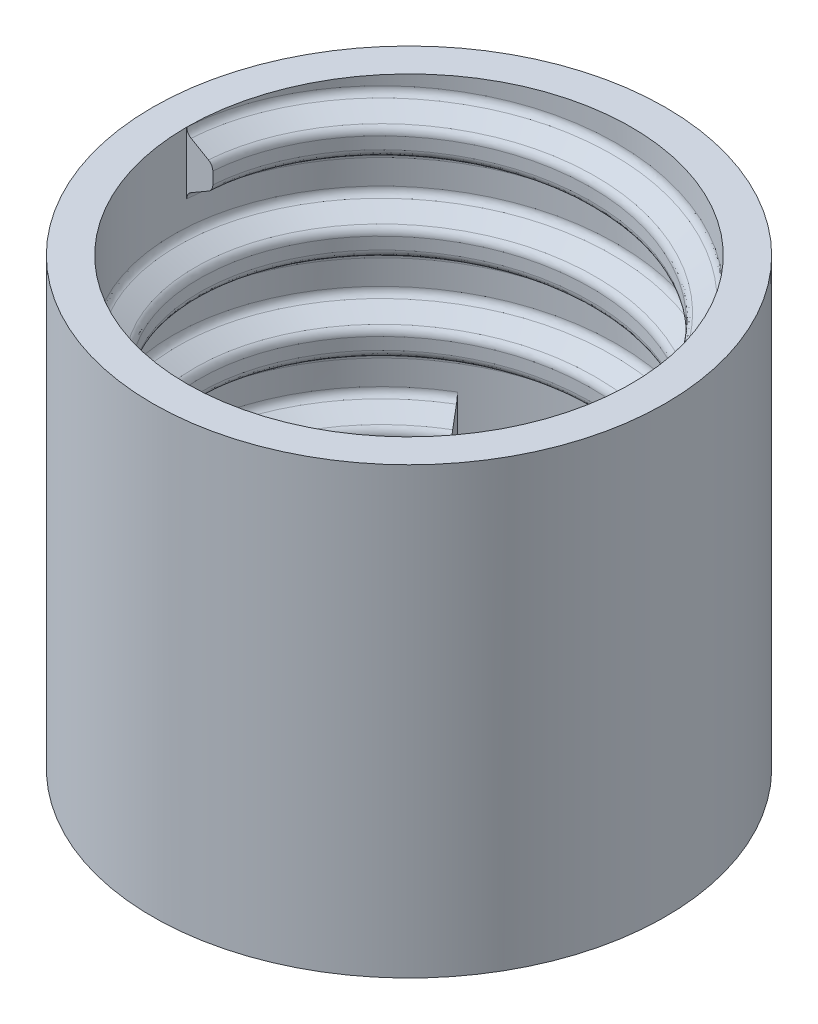
from build123d import *
from build123d.topology import SkipClean

# Parameters (mm, degrees)
SKETCH1_R           = 15
BOSS_EXTRUDE1_DEPTH = 20
SKETCH10_R          = 13
CUT_EXTRUDE2_DEPTH  = 20
THREAD1_PITCH       = 5.08
BOSS_EXTRUDE3_START = 6
SKETCH20_R          = 15
BOSS_EXTRUDE3_DEPTH = 6
SKETCH19_R          = 6.5
CUT_EXTRUDE3_DEPTH  = 1.5
SKETCH47_R          = 0.5
CUT_EXTRUDE10_DEPTH = 4.5
SKETCH49_R          = 0.5
CUT_EXTRUDE13_DEPTH = 4.5
SKETCH50_R          = 0.5
CUT_EXTRUDE14_DEPTH = 4.5
SKETCH51_R          = 0.5
CUT_EXTRUDE15_DEPTH = 4.5
CIRPATTERN1_COUNT   = 18
CIRPATTERN2_COUNT   = 12
CIRPATTERN3_COUNT   = 6


with BuildPart() as part:
    # Sketch1 → Boss-Extrude1 (new body)
    with BuildSketch(Plane(origin=(0, 0, 0), x_dir=(1, 0, 0), z_dir=(0, 1, 0))):
        with Locations(Location((0, 0, 0), (0, 0, 270))):
            Circle(SKETCH1_R)
    extrude(amount=BOSS_EXTRUDE1_DEPTH)

    # Sketch10 → Cut-Extrude2 (cut)
    with BuildSketch(Plane(origin=(0, 20, 0), x_dir=(1, 0, 0), z_dir=(0, 1, 0))):
        with Locations(Location((0, 0, 0), (0, 0, 270))):
            Circle(SKETCH10_R)
    extrude(amount=-CUT_EXTRUDE2_DEPTH, mode=Mode.SUBTRACT)

    # Thread1: the profile of Thread Profile2 profile screwed along a right-hand helix of 3.149606 turns, 12 arcs to a turn; built about Z, then put on its axis
    with SkipClean():  # the faces are left unmerged after this step: merging them gives an invalid solid
        thread1_z = Axis((0, 0, 0), (0, 0, 1))
        thread1_corners = [(13.0006, 0, 0), (13.0006, 0, 3.634587873), (13, 0, 3.634587873), (12.746, 0, 3.194646968), (11.73, 0, 2.608059095), (11.476, 0, 2.16811819), (11.476, 0, 1.466469684), (11.73, 0, 1.026528779), (12.746, 0, 0.439940905), (13, 0, 0)]
        with BuildLine(mode=Mode.PRIVATE) as thread1_profile:
            Line(thread1_corners[0], thread1_corners[1])
            Line(thread1_corners[3], thread1_corners[4])
            Line(thread1_corners[5], thread1_corners[6])
            Line(thread1_corners[7], thread1_corners[8])
            Line(thread1_corners[9], thread1_corners[0])
            Line(thread1_corners[2], thread1_corners[1])
            ThreePointArc((13, 0, 3.634587873), (12.931940905, 0, 3.380587873), (12.746, 0, 3.194646968))
            ThreePointArc((11.73, 0, 2.608059095), (11.544059095, 0, 2.42211819), (11.476, 0, 2.16811819))
            ThreePointArc((11.476, 0, 1.466469684), (11.544059095, 0, 1.212469684), (11.73, 0, 1.026528779))
            ThreePointArc((12.746, 0, 0.439940905), (12.931940905, 0, 0.254), (13, 0, 0))
        thread1_cap = Face(thread1_profile.wire())
        thread1_arcs = [((13, 0, 3.634587873), (13, 0, 3.341293937), (12.746, 0, 3.194646968), (1, 0.866025403784437, 1)), ((11.73, 0, 2.608059095), (11.476, 0, 2.461412127), (11.476, 0, 2.16811819), (1, 0.8660254037844386, 1)), ((11.476, 0, 1.466469684), (11.476, 0, 1.173175747), (11.73, 0, 1.026528779), (1, 0.8660254037844376, 1)), ((12.746, 0, 0.439940905), (13, 0, 0.293293937), (13, 0, 0), (1, 0.8660254037844372, 1))]  # start, shoulder, end, weights
        thread1_turn_angles = [0, 15, 30, 45, 60, 75, 90, 105, 120, 135, 150, 165, 180, 195, 210, 225, 240, 255, 270, 285, 300, 315, 330, 345, 360]
        thread1_turn_weights = [1, 0.9659258262890683, 1, 0.9659258262890683, 1, 0.9659258262890683, 1, 0.9659258262890683, 1, 0.9659258262890683, 1, 0.9659258262890683, 1, 0.9659258262890683, 1, 0.9659258262890683, 1, 0.9659258262890683, 1, 0.9659258262890683, 1, 0.9659258262890683, 1, 0.9659258262890683, 1]
        thread1_turn_rails = [Edge.make_bspline([Vector(p[0], p[1], 0).rotate(thread1_z, thread1_turn_angles[k]) / thread1_turn_weights[k] + Vector(0, 0, p[2] + THREAD1_PITCH * thread1_turn_angles[k] / 360) for k in range(25)], [0, 0, 0, 1, 1, 2, 2, 3, 3, 4, 4, 5, 5, 6, 6, 7, 7, 8, 8, 9, 9, 10, 10, 11, 11, 12, 12, 12], 2, thread1_turn_weights) for p in thread1_corners]
        thread1_turn_sides = [*[Face.make_surface_from_curves(thread1_turn_rails[p[0]], thread1_turn_rails[p[1]]) for p in [(0, 1), (3, 4), (5, 6), (7, 8), (9, 0), (2, 1)]], *[Face.make_bezier_surface([[Vector(p[j][0], p[j][1], 0).rotate(thread1_z, thread1_turn_angles[2 * i + k]) / thread1_turn_weights[2 * i + k] + Vector(0, 0, p[j][2] + THREAD1_PITCH * thread1_turn_angles[2 * i + k] / 360) for k in range(3)] for j in range(3)], [[p[3][j] * thread1_turn_weights[2 * i + k] for k in range(3)] for j in range(3)]) for p in thread1_arcs for i in range(12)]]
        thread1_last_angles = [1080, 1095, 1110, 1121.929133858, 1133.858267717]
        thread1_last_weights = [1, 0.9659258262890683, 1, 0.9784040075425771, 1]
        thread1_last_rails = [Edge.make_bspline([Vector(p[0], p[1], 0).rotate(thread1_z, thread1_last_angles[k]) / thread1_last_weights[k] + Vector(0, 0, p[2] + THREAD1_PITCH * thread1_last_angles[k] / 360) for k in range(5)], [0, 0, 0, 1, 1, 2, 2, 2], 2, thread1_last_weights) for p in thread1_corners]
        thread1_last_sides = [*[Face.make_surface_from_curves(thread1_last_rails[p[0]], thread1_last_rails[p[1]]) for p in [(0, 1), (3, 4), (5, 6), (7, 8), (9, 0), (2, 1)]], *[Face.make_bezier_surface([[Vector(p[j][0], p[j][1], 0).rotate(thread1_z, thread1_last_angles[2 * i + k]) / thread1_last_weights[2 * i + k] + Vector(0, 0, p[j][2] + THREAD1_PITCH * thread1_last_angles[2 * i + k] / 360) for k in range(3)] for j in range(3)], [[p[3][j] * thread1_last_weights[2 * i + k] for k in range(3)] for j in range(3)]) for p in thread1_arcs for i in range(2)]]
        thread1 = Plane(origin=(0, 20, 0), x_dir=(-1, 0, 0), z_dir=(0, -1, 0)) * Solid(Shell([*[p.moved(Location((0, 0, THREAD1_PITCH * i))) for i in range(3) for p in thread1_turn_sides], *thread1_last_sides, thread1_cap, thread1_cap.rotate(thread1_z, 1133.858267717).moved(Location((0, 0, THREAD1_PITCH * 1133.858267717 / 360)))]))
        add(thread1)

    # Sketch20 → Boss-Extrude3 (add)
    with SkipClean():  # the faces are left unmerged after this step: merging them gives an invalid solid
        with BuildSketch(Plane.XZ.offset(BOSS_EXTRUDE3_START)):
            with Locations(Location((0, 0, 0), (0, 0, 270))):
                Circle(SKETCH20_R)
        extrude(amount=-BOSS_EXTRUDE3_DEPTH)

    # Sketch19 → Cut-Extrude3 (cut)
    with SkipClean():  # the faces are left unmerged after this step: merging them gives an invalid solid
        with BuildSketch(Plane(origin=(0, 0, 0), x_dir=(-1, 0, 0), z_dir=(0, -1, 0))):
            with Locations(Location((0, 0, 0), (0, 0, 90))):
                Circle(SKETCH19_R)
        extrude(amount=CUT_EXTRUDE3_DEPTH, mode=Mode.SUBTRACT)

    # Sketch47 → Cut-Extrude10 (cut)
    with SkipClean():  # the faces are left unmerged after this step: merging them gives an invalid solid
        with BuildSketch(Plane(origin=(0, -1.5, 0), x_dir=(1, 0, 0), z_dir=(0, 1, 0))):
            with Locations(Location((0, 0, 0), (0, 0, 270))):
                Circle(SKETCH47_R)
        extrude(amount=-CUT_EXTRUDE10_DEPTH, mode=Mode.SUBTRACT)

    # Sketch49 → Cut-Extrude13 (cut)
    with SkipClean():  # the faces are left unmerged after this step: merging them gives an invalid solid
        with BuildSketch(Plane(origin=(0, -1.5, 0), x_dir=(1, 0, 0), z_dir=(0, 1, 0))):
            with Locations(Location((0, 0, 0), (0, 0, 270))):
                Circle(SKETCH49_R)
            with Locations(Location((1.67, 0, 0), (0, 0, 270))):
                Circle(SKETCH49_R)
        cut_extrude13 = extrude(amount=-CUT_EXTRUDE13_DEPTH, mode=Mode.SUBTRACT)

    # Sketch50 → Cut-Extrude14 (cut)
    with SkipClean():  # the faces are left unmerged after this step: merging them gives an invalid solid
        with BuildSketch(Plane(origin=(0, -1.5, 0), x_dir=(1, 0, 0), z_dir=(0, 1, 0))):
            with Locations(Location((3.33, 0, 0), (0, 0, 270))):
                Circle(SKETCH50_R)
        cut_extrude14 = extrude(amount=-CUT_EXTRUDE14_DEPTH, mode=Mode.SUBTRACT)

    # Sketch51 → Cut-Extrude15 (cut)
    with SkipClean():  # the faces are left unmerged after this step: merging them gives an invalid solid
        with BuildSketch(Plane(origin=(0, -1.5, 0), x_dir=(1, 0, 0), z_dir=(0, 1, 0))):
            with Locations(Location((5, 0, 0), (0, 0, 270))):
                Circle(SKETCH51_R)
        cut_extrude15 = extrude(amount=-CUT_EXTRUDE15_DEPTH, mode=Mode.SUBTRACT)

    # CirPattern1: Cut-Extrude15 ×18 about axis
    with SkipClean():  # the faces are left unmerged after this step: merging them gives an invalid solid
        cirpattern1_axis = Axis((0, 0, 0), (0, 1, 0))
        for i in range(1, CIRPATTERN1_COUNT):
            add(cut_extrude15.rotate(cirpattern1_axis, i * 360 / CIRPATTERN1_COUNT), mode=Mode.SUBTRACT)

    # CirPattern2: Cut-Extrude14 ×12 about axis
    with SkipClean():  # the faces are left unmerged after this step: merging them gives an invalid solid
        cirpattern2_axis = Axis((0, 0, 0), (0, 1, 0))
        for i in range(1, CIRPATTERN2_COUNT):
            add(cut_extrude14.rotate(cirpattern2_axis, i * 360 / CIRPATTERN2_COUNT), mode=Mode.SUBTRACT)

    # CirPattern3: Cut-Extrude13 ×6 about axis
    with SkipClean():  # the faces are left unmerged after this step: merging them gives an invalid solid
        cirpattern3_axis = Axis((0, 0, 0), (0, 1, 0))
        for i in range(1, CIRPATTERN3_COUNT):
            add(cut_extrude13.rotate(cirpattern3_axis, i * 360 / CIRPATTERN3_COUNT), mode=Mode.SUBTRACT)


solid = part.part
